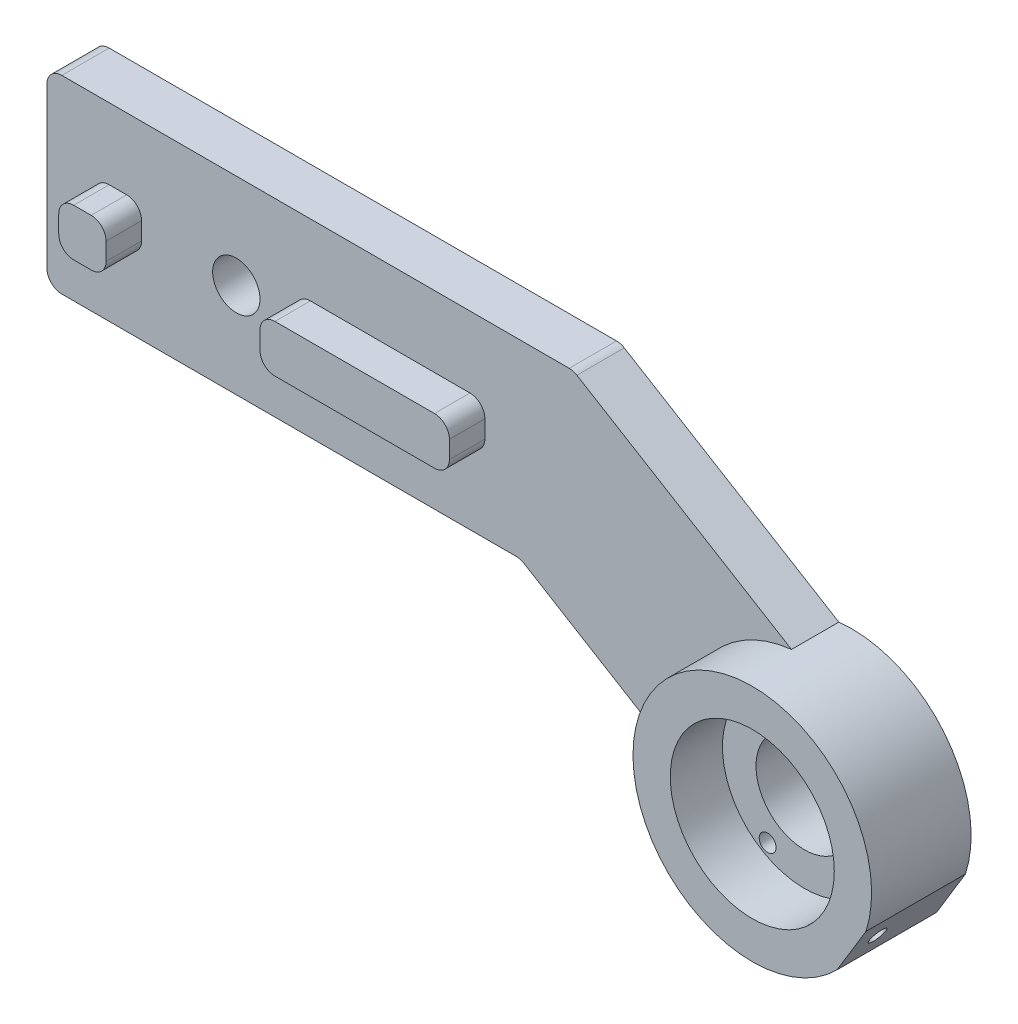
from build123d import *

# Parameters (mm, degrees)
SKETCH1_R           = 3.175
SKETCH1_R_2         = 6.5
SKETCH1_R_3         = 1.1303
BOSS_EXTRUDE1_DEPTH = 6.35
SKETCH5_W           = 25.4
SKETCH5_H           = 6.35
SKETCH5_W_2         = 6.35
BOSS_EXTRUDE3_DEPTH = 4.7625
SKETCH4_R           = 11
BOSS_EXTRUDE2_DEPTH = 7
CUT_EXTRUDE1_REACH  = 122.641
SKETCH2_R           = 1.1303
FILLET3_R           = 2


with BuildPart() as part:
    # Sketch1 → Boss-Extrude1 (new body)
    with BuildSketch(Plane.XY):
        with BuildLine():
            Line((-25.4, -12.7), (-25.4, 12.7))
            Line((-25.4, 12.7), (45.199208724, 12.7))
            Line((45.199208724, 12.7), (74.463216326, -5.044542368))
            ThreePointArc((74.463216326, -5.044542368), (88.585378941, -10.82071629), (91.444603929, -25.808194216))
            Line((91.444603929, -25.808194216), (87.555933896, -32.221324916))
            ThreePointArc((87.555933896, -32.221324916), (72.944550454, -36.615313538), (61.293587146, -26.763678338))
            Line((61.293587146, -26.763678338), (38.1, -12.7))
            Line((38.1, -12.7), (-25.4, -12.7))
        make_face()
        Circle(SKETCH1_R, mode=Mode.SUBTRACT)
        with Locations((76.2, -20.95)):
            Circle(SKETCH1_R_2, mode=Mode.SUBTRACT)
        with Locations((81.138610942, -12.805324011)):
            Circle(SKETCH1_R_3, mode=Mode.SUBTRACT)
        with Locations((71.261389058, -29.094675989)):
            Circle(SKETCH1_R_3, mode=Mode.SUBTRACT)
    extrude(amount=BOSS_EXTRUDE1_DEPTH)

    # Sketch5 → Boss-Extrude3 (add)
    with BuildSketch(Plane.XY.offset(6.35)):
        with Locations((20.6375, 0)):
            Rectangle(SKETCH5_W, SKETCH5_H)
        with Locations((-15.875, 0)):
            Rectangle(SKETCH5_W_2, SKETCH5_H)
    extrude(amount=BOSS_EXTRUDE3_DEPTH)

    # Sketch4 → Boss-Extrude2 (add)
    with BuildSketch(Plane.XY.offset(6.35)):
        with BuildLine():
            Line((91.444603929, -25.808194216), (87.555933896, -32.221324916))
            ThreePointArc((87.555933896, -32.221324916), (62.518654507, -12.654170595), (91.444603929, -25.808194216))
        make_face()
        with Locations((76.2, -20.95)):
            Circle(SKETCH4_R, mode=Mode.SUBTRACT)
    extrude(amount=BOSS_EXTRUDE2_DEPTH)

    # Sketch2 → Cut-Extrude1 (cut, up to next)
    with BuildSketch(Plane(origin=(78.303556067, -47.480194346, 0), x_dir=(0, 0, -1), z_dir=(0.8550840932924629, -0.5184893377864258, 0)), mode=Mode.PRIVATE) as cut_extrude1_sk1:
        with Locations((-9.85, 21.594875785)):
            Circle(SKETCH2_R)
    cut_extrude1_tool1 = extrude(cut_extrude1_sk1.sketch, amount=-CUT_EXTRUDE1_REACH, mode=Mode.PRIVATE) & part.part
    add(cut_extrude1_tool1.solids().sort_by_distance((89.500269, -29.01476, 9.85))[0], mode=Mode.SUBTRACT)

    # Fillet3
    fillet3_edges = [part.edges().sort_by_distance(p)[0] for p in [
        (-25.4, -12.7, 3.175),
        (-25.4, 12.7, 3.175),
        (45.199208724, 12.7, 3.175),
        (38.1, -12.7, 3.175),
        (-19.05, -3.175, 8.73125),
        (-12.7, -3.175, 8.73125),
        (7.9375, -3.175, 8.73125),
        (33.3375, -3.175, 8.73125),
        (7.9375, 3.175, 8.73125),
        (33.3375, 3.175, 8.73125),
        (-12.7, 3.175, 8.73125),
        (-19.05, 3.175, 8.73125),
    ]]
    fillet(fillet3_edges, radius=FILLET3_R)


solid = part.part
